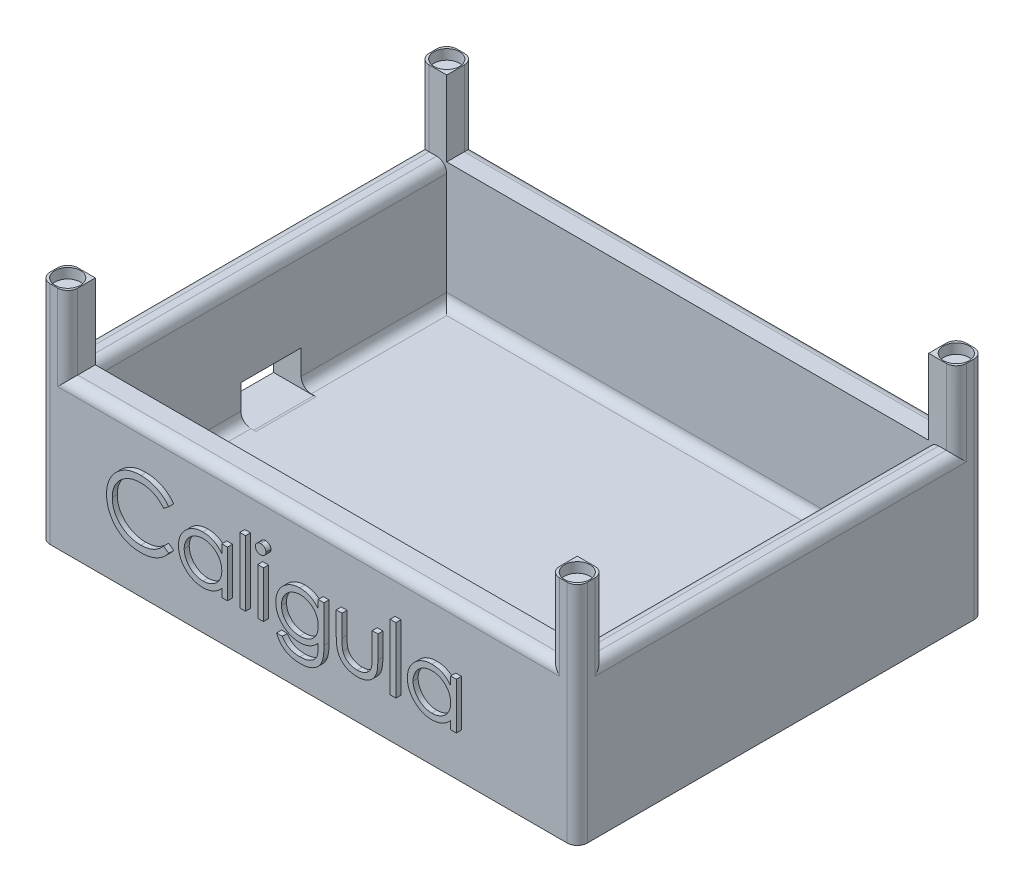
from build123d import *

# Parameters (mm, degrees)
SKETCH3_W                                  = 107
SKETCH3_H                                  = 81
BOSS_EXTRUDE1_DEPTH                        = 30
SHELL1_T                                   = -5.5
SKETCH4_W                                  = 5.5
SKETCH4_H                                  = 5.5
BOSS_EXTRUDE2_DEPTH                        = 15
MIRROR1_AT_THE_SECOND_PLANE_COPY_1_SKETC_W = 5.5
MIRROR1_AT_THE_SECOND_PLANE_COPY_1_SKETC_H = 5.5
MIRROR1_AT_THE_SECOND_PLANE_COPY_1_DEPTH   = 15
SKETCH5_R                                  = 2.55
CUT_EXTRUDE1_DEPTH                         = 2
MIRROR2_AT_THE_SECOND_PLANE_COPY_1_SKETC_R = 2.55
MIRROR2_AT_THE_SECOND_PLANE_COPY_1_DEPTH   = 2
SKETCH6_W                                  = 12
SKETCH6_H                                  = 7
CUT_EXTRUDE2_DEPTH                         = 8
FILLET4_R                                  = 2
FILLET5_R                                  = 2
WRAP1_START                                = -1
WRAP1_OUTLINE_W                            = 1.13974359
WRAP1_OUTLINE_H                            = 13.025641025
WRAP1_OUTLINE_H_2                          = 9.28076923
WRAP1_DEPTH                                = 2


with BuildPart() as part:
    # Sketch3 → Boss-Extrude1 (new body)
    with BuildSketch(Plane(origin=(0, 0, 0), x_dir=(1, 0, 0), z_dir=(0, 1, 0))):
        Rectangle(SKETCH3_W, SKETCH3_H)
    extrude(amount=BOSS_EXTRUDE1_DEPTH)

    # Shell1
    shell1_openings = [part.faces().sort_by_distance(p)[0] for p in [
        (0, 30, 0),
    ]]
    offset(amount=SHELL1_T, openings=shell1_openings, kind=Kind.INTERSECTION)

    # Sketch4 → Boss-Extrude2 (add)
    with BuildSketch(Plane(origin=(0, 30, 0), x_dir=(1, 0, 0), z_dir=(0, 1, 0))):
        with Locations((-50.75, 37.75)):
            Rectangle(SKETCH4_W, SKETCH4_H)
    boss_extrude2 = extrude(amount=BOSS_EXTRUDE2_DEPTH)

    # Mirror1: Boss-Extrude2 across plane
    add(boss_extrude2.mirror(Plane(origin=(0, 0, 0), x_dir=(0, 0, 1), z_dir=(1, 0, 0))))

    # Mirror1 at the second plane: Boss-Extrude2 across plane
    add(boss_extrude2.mirror(Plane.XY))

    # Mirror1 at the second plane copy 1 sketc → Mirror1 at the second plane copy 1 (add)
    with BuildSketch(Plane(origin=(0, 30, 0), x_dir=(-1, 0, 0), z_dir=(0, 1, 0))):
        with Locations((-50.75, 37.75)):
            Rectangle(MIRROR1_AT_THE_SECOND_PLANE_COPY_1_SKETC_W, MIRROR1_AT_THE_SECOND_PLANE_COPY_1_SKETC_H)
    extrude(amount=MIRROR1_AT_THE_SECOND_PLANE_COPY_1_DEPTH)

    # Sketch5 → Cut-Extrude1 (cut)
    with BuildSketch(Plane(origin=(0, 45, 0), x_dir=(1, 0, 0), z_dir=(0, 1, 0))):
        with Locations(Location((-50.75, 37.75, 0), (0, 0, 270))):
            Circle(SKETCH5_R)
    cut_extrude1 = extrude(amount=-CUT_EXTRUDE1_DEPTH, mode=Mode.SUBTRACT)

    # Mirror2: Cut-Extrude1 across plane
    add(cut_extrude1.mirror(Plane(origin=(0, 0, 0), x_dir=(0, 0, 1), z_dir=(1, 0, 0))), mode=Mode.SUBTRACT)

    # Mirror2 at the second plane: Cut-Extrude1 across plane
    add(cut_extrude1.mirror(Plane.XY), mode=Mode.SUBTRACT)

    # Mirror2 at the second plane copy 1 sketc → Mirror2 at the second plane copy 1 (cut)
    with BuildSketch(Plane(origin=(0, 45, 0), x_dir=(-1, 0, 0), z_dir=(0, 1, 0))):
        with Locations(Location((-50.75, 37.75, 0), (0, 0, 270))):
            Circle(MIRROR2_AT_THE_SECOND_PLANE_COPY_1_SKETC_R)
    extrude(amount=-MIRROR2_AT_THE_SECOND_PLANE_COPY_1_DEPTH, mode=Mode.SUBTRACT)

    # Sketch6 → Cut-Extrude2 (cut)
    with BuildSketch(Plane.ZY.offset(53.5)):
        with Locations((0, 8.935337708)):
            Rectangle(SKETCH6_W, SKETCH6_H)
    extrude(amount=-CUT_EXTRUDE2_DEPTH, mode=Mode.SUBTRACT)

    # Fillet4
    # the kernel refuses this fillet: 2 mm, written as the material it takes off along each edge
    with BuildSketch(Plane(origin=(-48, 30, 35), x_dir=(-1, 0, 0), z_dir=(0, 0, -1)), Plane(origin=(48, 30, -35), x_dir=(1, 0, 0), z_dir=(0, 0, 1))) as fillet4_piece_1:
        with BuildLine():
            CenterArc((FILLET4_R, -FILLET4_R), FILLET4_R, 90, 90)
            Line((0, -FILLET4_R), (0, 0))
            Line((0, 0), (FILLET4_R, 0))
        make_face()
    extrude(amount=70, mode=Mode.SUBTRACT)
    with BuildSketch(Plane(origin=(-53.5, 30, -35), x_dir=(0, -1, 0), z_dir=(0, 0, 1)), Plane(origin=(53.5, 30, 35), x_dir=(0, -1, 0), z_dir=(0, 0, -1))) as fillet4_piece_2:
        with BuildLine():
            CenterArc((FILLET4_R, FILLET4_R), FILLET4_R, 180, 90)
            Line((0, FILLET4_R), (0, 0))
            Line((0, 0), (FILLET4_R, 0))
        make_face()
    extrude(amount=70, mode=Mode.SUBTRACT)
    with BuildSketch(Plane(origin=(-53.5, 30, -35), x_dir=(0, 0, -1), z_dir=(0, 1, 0)), Plane(origin=(-48, 30, 40.5), x_dir=(-1, 0, 0), z_dir=(0, 1, 0)), Plane(origin=(48, 30, -40.5), x_dir=(1, 0, 0), z_dir=(0, 1, 0)), Plane(origin=(53.5, 30, 35), x_dir=(0, 0, 1), z_dir=(0, 1, 0))) as fillet4_piece_3:
        with BuildLine():
            CenterArc((FILLET4_R, -FILLET4_R), FILLET4_R, 90, 90)
            Line((0, -FILLET4_R), (0, 0))
            Line((0, 0), (FILLET4_R, 0))
        make_face()
    extrude(amount=20, mode=Mode.SUBTRACT)
    with BuildSketch(Plane(origin=(-48, 30, -40.5), x_dir=(-1, 0, 0), z_dir=(0, 1, 0)), Plane(origin=(-53.5, 30, 35), x_dir=(0, 0, 1), z_dir=(0, 1, 0)), Plane(origin=(53.5, 30, -35), x_dir=(0, 0, -1), z_dir=(0, 1, 0)), Plane(origin=(48, 30, 40.5), x_dir=(1, 0, 0), z_dir=(0, 1, 0))) as fillet4_piece_4:
        with BuildLine():
            CenterArc((FILLET4_R, FILLET4_R), FILLET4_R, 180, 90)
            Line((0, FILLET4_R), (0, 0))
            Line((0, 0), (FILLET4_R, 0))
        make_face()
    extrude(amount=20, mode=Mode.SUBTRACT)
    with BuildSketch(Plane(origin=(-48, 30, 40.5), x_dir=(0, -1, 0), z_dir=(1, 0, 0)), Plane(origin=(48, 30, -40.5), x_dir=(0, -1, 0), z_dir=(-1, 0, 0))) as fillet4_piece_5:
        with BuildLine():
            CenterArc((FILLET4_R, FILLET4_R), FILLET4_R, 180, 90)
            Line((0, FILLET4_R), (0, 0))
            Line((0, 0), (FILLET4_R, 0))
        make_face()
    extrude(amount=96, mode=Mode.SUBTRACT)
    with BuildSketch(Plane(origin=(-53.5, -5, -40.5), x_dir=(1, 0, 0), z_dir=(0, 1, 0)), Plane(origin=(53.5, 50, -40.5), x_dir=(-1, 0, 0), z_dir=(0, -1, 0)), Plane(origin=(53.5, 50, 40.5), x_dir=(0, 0, -1), z_dir=(0, -1, 0)), Plane(origin=(-53.5, -5, 40.5), x_dir=(0, 0, -1), z_dir=(0, 1, 0))) as fillet4_piece_6:
        with BuildLine():
            CenterArc((FILLET4_R, -FILLET4_R), FILLET4_R, 90, 90)
            Line((0, -FILLET4_R), (0, 0))
            Line((0, 0), (FILLET4_R, 0))
        make_face()
    extrude(amount=55, mode=Mode.SUBTRACT)
    with BuildSketch(Plane(origin=(-53.5, 25, -35), x_dir=(0, 0, -1), z_dir=(0, 1, 0))) as fillet4_piece_7a_section:
        with BuildLine():
            CenterArc((FILLET4_R, -FILLET4_R), FILLET4_R, 90, 90)
            Line((0, -FILLET4_R), (0, 0))
            Line((0, 0), (FILLET4_R, 0))
        make_face()
    fillet4_piece_7a = extrude(amount=25, mode=Mode.PRIVATE)
    fillet4_piece_7a = split(fillet4_piece_7a, bisect_by=Plane(origin=(-53.5, 30, -35), z_dir=(0, -1, 0)), keep=Keep.TOP, mode=Mode.PRIVATE)
    with BuildSketch(Plane(origin=(-53.5, 30, -40), x_dir=(0, -1, 0), z_dir=(0, 0, 1))) as fillet4_piece_7b_section:
        with BuildLine():
            CenterArc((FILLET4_R, FILLET4_R), FILLET4_R, 180, 90)
            Line((0, FILLET4_R), (0, 0))
            Line((0, 0), (FILLET4_R, 0))
        make_face()
    fillet4_piece_7b = extrude(amount=75, mode=Mode.PRIVATE)
    fillet4_piece_7b = split(fillet4_piece_7b, bisect_by=Plane(origin=(-53.5, 30, -35), z_dir=(0, 0, -1)), keep=Keep.TOP, mode=Mode.PRIVATE)
    fillet4_piece_7 = fillet4_piece_7a & fillet4_piece_7b
    add(fillet4_piece_7, mode=Mode.SUBTRACT)
    with BuildSketch(Plane(origin=(-53.5, 30, -35), x_dir=(0, -1, 0), z_dir=(0, 0, 1))) as fillet4_piece_8a_section:
        with BuildLine():
            CenterArc((FILLET4_R, FILLET4_R), FILLET4_R, 180, 90)
            Line((0, FILLET4_R), (0, 0))
            Line((0, 0), (FILLET4_R, 0))
        make_face()
    fillet4_piece_8a = extrude(amount=75, mode=Mode.PRIVATE)
    fillet4_piece_8a = split(fillet4_piece_8a, bisect_by=Plane(origin=(-53.5, 30, 35), z_dir=(0, 0, 1)), keep=Keep.TOP, mode=Mode.PRIVATE)
    with BuildSketch(Plane(origin=(-53.5, 25, 35), x_dir=(0, 0, 1), z_dir=(0, 1, 0))) as fillet4_piece_8b_section:
        with BuildLine():
            CenterArc((FILLET4_R, FILLET4_R), FILLET4_R, 180, 90)
            Line((0, FILLET4_R), (0, 0))
            Line((0, 0), (FILLET4_R, 0))
        make_face()
    fillet4_piece_8b = extrude(amount=25, mode=Mode.PRIVATE)
    fillet4_piece_8b = split(fillet4_piece_8b, bisect_by=Plane(origin=(-53.5, 30, 35), z_dir=(0, -1, 0)), keep=Keep.TOP, mode=Mode.PRIVATE)
    fillet4_piece_8 = fillet4_piece_8a & fillet4_piece_8b
    add(fillet4_piece_8, mode=Mode.SUBTRACT)
    with BuildSketch(Plane(origin=(48, 30, -40.5), x_dir=(0, -1, 0), z_dir=(-1, 0, 0))) as fillet4_piece_9a_section:
        with BuildLine():
            CenterArc((FILLET4_R, FILLET4_R), FILLET4_R, 180, 90)
            Line((0, FILLET4_R), (0, 0))
            Line((0, 0), (FILLET4_R, 0))
        make_face()
    fillet4_piece_9a = extrude(amount=101, mode=Mode.PRIVATE)
    fillet4_piece_9a = split(fillet4_piece_9a, bisect_by=Plane(origin=(-48, 30, -40.5), z_dir=(-1, 0, 0)), keep=Keep.TOP, mode=Mode.PRIVATE)
    with BuildSketch(Plane(origin=(-48, 25, -40.5), x_dir=(-1, 0, 0), z_dir=(0, 1, 0))) as fillet4_piece_9b_section:
        with BuildLine():
            CenterArc((FILLET4_R, FILLET4_R), FILLET4_R, 180, 90)
            Line((0, FILLET4_R), (0, 0))
            Line((0, 0), (FILLET4_R, 0))
        make_face()
    fillet4_piece_9b = extrude(amount=25, mode=Mode.PRIVATE)
    fillet4_piece_9b = split(fillet4_piece_9b, bisect_by=Plane(origin=(-48, 30, -40.5), z_dir=(0, -1, 0)), keep=Keep.TOP, mode=Mode.PRIVATE)
    fillet4_piece_9 = fillet4_piece_9a & fillet4_piece_9b
    add(fillet4_piece_9, mode=Mode.SUBTRACT)
    with BuildSketch(Plane(origin=(-48, 25, 40.5), x_dir=(-1, 0, 0), z_dir=(0, 1, 0))) as fillet4_piece_10a_section:
        with BuildLine():
            CenterArc((FILLET4_R, -FILLET4_R), FILLET4_R, 90, 90)
            Line((0, -FILLET4_R), (0, 0))
            Line((0, 0), (FILLET4_R, 0))
        make_face()
    fillet4_piece_10a = extrude(amount=25, mode=Mode.PRIVATE)
    fillet4_piece_10a = split(fillet4_piece_10a, bisect_by=Plane(origin=(-48, 30, 40.5), z_dir=(0, -1, 0)), keep=Keep.TOP, mode=Mode.PRIVATE)
    with BuildSketch(Plane(origin=(-53, 30, 40.5), x_dir=(0, -1, 0), z_dir=(1, 0, 0))) as fillet4_piece_10b_section:
        with BuildLine():
            CenterArc((FILLET4_R, FILLET4_R), FILLET4_R, 180, 90)
            Line((0, FILLET4_R), (0, 0))
            Line((0, 0), (FILLET4_R, 0))
        make_face()
    fillet4_piece_10b = extrude(amount=101, mode=Mode.PRIVATE)
    fillet4_piece_10b = split(fillet4_piece_10b, bisect_by=Plane(origin=(-48, 30, 40.5), z_dir=(-1, 0, 0)), keep=Keep.TOP, mode=Mode.PRIVATE)
    fillet4_piece_10 = fillet4_piece_10a & fillet4_piece_10b
    add(fillet4_piece_10, mode=Mode.SUBTRACT)
    with BuildSketch(Plane(origin=(-48, 30, 40.5), x_dir=(0, -1, 0), z_dir=(1, 0, 0))) as fillet4_piece_11a_section:
        with BuildLine():
            CenterArc((FILLET4_R, FILLET4_R), FILLET4_R, 180, 90)
            Line((0, FILLET4_R), (0, 0))
            Line((0, 0), (FILLET4_R, 0))
        make_face()
    fillet4_piece_11a = extrude(amount=101, mode=Mode.PRIVATE)
    fillet4_piece_11a = split(fillet4_piece_11a, bisect_by=Plane(origin=(48, 30, 40.5), z_dir=(1, 0, 0)), keep=Keep.TOP, mode=Mode.PRIVATE)
    with BuildSketch(Plane(origin=(48, 25, 40.5), x_dir=(1, 0, 0), z_dir=(0, 1, 0))) as fillet4_piece_11b_section:
        with BuildLine():
            CenterArc((FILLET4_R, FILLET4_R), FILLET4_R, 180, 90)
            Line((0, FILLET4_R), (0, 0))
            Line((0, 0), (FILLET4_R, 0))
        make_face()
    fillet4_piece_11b = extrude(amount=25, mode=Mode.PRIVATE)
    fillet4_piece_11b = split(fillet4_piece_11b, bisect_by=Plane(origin=(48, 30, 40.5), z_dir=(0, -1, 0)), keep=Keep.TOP, mode=Mode.PRIVATE)
    fillet4_piece_11 = fillet4_piece_11a & fillet4_piece_11b
    add(fillet4_piece_11, mode=Mode.SUBTRACT)
    with BuildSketch(Plane(origin=(48, 25, -40.5), x_dir=(1, 0, 0), z_dir=(0, 1, 0))) as fillet4_piece_12a_section:
        with BuildLine():
            CenterArc((FILLET4_R, -FILLET4_R), FILLET4_R, 90, 90)
            Line((0, -FILLET4_R), (0, 0))
            Line((0, 0), (FILLET4_R, 0))
        make_face()
    fillet4_piece_12a = extrude(amount=25, mode=Mode.PRIVATE)
    fillet4_piece_12a = split(fillet4_piece_12a, bisect_by=Plane(origin=(48, 30, -40.5), z_dir=(0, -1, 0)), keep=Keep.TOP, mode=Mode.PRIVATE)
    with BuildSketch(Plane(origin=(53, 30, -40.5), x_dir=(0, -1, 0), z_dir=(-1, 0, 0))) as fillet4_piece_12b_section:
        with BuildLine():
            CenterArc((FILLET4_R, FILLET4_R), FILLET4_R, 180, 90)
            Line((0, FILLET4_R), (0, 0))
            Line((0, 0), (FILLET4_R, 0))
        make_face()
    fillet4_piece_12b = extrude(amount=101, mode=Mode.PRIVATE)
    fillet4_piece_12b = split(fillet4_piece_12b, bisect_by=Plane(origin=(48, 30, -40.5), z_dir=(1, 0, 0)), keep=Keep.TOP, mode=Mode.PRIVATE)
    fillet4_piece_12 = fillet4_piece_12a & fillet4_piece_12b
    add(fillet4_piece_12, mode=Mode.SUBTRACT)
    with BuildSketch(Plane(origin=(53.5, 30, 35), x_dir=(0, -1, 0), z_dir=(0, 0, -1))) as fillet4_piece_13a_section:
        with BuildLine():
            CenterArc((FILLET4_R, FILLET4_R), FILLET4_R, 180, 90)
            Line((0, FILLET4_R), (0, 0))
            Line((0, 0), (FILLET4_R, 0))
        make_face()
    fillet4_piece_13a = extrude(amount=75, mode=Mode.PRIVATE)
    fillet4_piece_13a = split(fillet4_piece_13a, bisect_by=Plane(origin=(53.5, 30, -35), z_dir=(0, 0, -1)), keep=Keep.TOP, mode=Mode.PRIVATE)
    with BuildSketch(Plane(origin=(53.5, 25, -35), x_dir=(0, 0, -1), z_dir=(0, 1, 0))) as fillet4_piece_13b_section:
        with BuildLine():
            CenterArc((FILLET4_R, FILLET4_R), FILLET4_R, 180, 90)
            Line((0, FILLET4_R), (0, 0))
            Line((0, 0), (FILLET4_R, 0))
        make_face()
    fillet4_piece_13b = extrude(amount=25, mode=Mode.PRIVATE)
    fillet4_piece_13b = split(fillet4_piece_13b, bisect_by=Plane(origin=(53.5, 30, -35), z_dir=(0, -1, 0)), keep=Keep.TOP, mode=Mode.PRIVATE)
    fillet4_piece_13 = fillet4_piece_13a & fillet4_piece_13b
    add(fillet4_piece_13, mode=Mode.SUBTRACT)
    with BuildSketch(Plane(origin=(53.5, 25, 35), x_dir=(0, 0, 1), z_dir=(0, 1, 0))) as fillet4_piece_14a_section:
        with BuildLine():
            CenterArc((FILLET4_R, -FILLET4_R), FILLET4_R, 90, 90)
            Line((0, -FILLET4_R), (0, 0))
            Line((0, 0), (FILLET4_R, 0))
        make_face()
    fillet4_piece_14a = extrude(amount=25, mode=Mode.PRIVATE)
    fillet4_piece_14a = split(fillet4_piece_14a, bisect_by=Plane(origin=(53.5, 30, 35), z_dir=(0, -1, 0)), keep=Keep.TOP, mode=Mode.PRIVATE)
    with BuildSketch(Plane(origin=(53.5, 30, 40), x_dir=(0, -1, 0), z_dir=(0, 0, -1))) as fillet4_piece_14b_section:
        with BuildLine():
            CenterArc((FILLET4_R, FILLET4_R), FILLET4_R, 180, 90)
            Line((0, FILLET4_R), (0, 0))
            Line((0, 0), (FILLET4_R, 0))
        make_face()
    fillet4_piece_14b = extrude(amount=75, mode=Mode.PRIVATE)
    fillet4_piece_14b = split(fillet4_piece_14b, bisect_by=Plane(origin=(53.5, 30, 35), z_dir=(0, 0, 1)), keep=Keep.TOP, mode=Mode.PRIVATE)
    fillet4_piece_14 = fillet4_piece_14a & fillet4_piece_14b
    add(fillet4_piece_14, mode=Mode.SUBTRACT)

    # Fillet5
    # the kernel refuses this fillet: 2 mm, written as the material it adds along each edge
    with BuildSketch(Plane(origin=(-53, 5.5, 35), x_dir=(0, 1, 0), z_dir=(1, 0, 0)), Plane(origin=(53, 5.5, -35), x_dir=(0, 1, 0), z_dir=(-1, 0, 0))) as fillet5_piece_1:
        with BuildLine():
            CenterArc((FILLET5_R, -FILLET5_R), FILLET5_R, 90, 90)
            Line((0, -FILLET5_R), (0, 0))
            Line((0, 0), (FILLET5_R, 0))
        make_face()
    extrude(amount=106)
    with BuildSketch(Plane(origin=(48, 5.5, 40), x_dir=(0, 1, 0), z_dir=(0, 0, -1))) as fillet5_piece_2:
        with BuildLine():
            CenterArc((FILLET5_R, -FILLET5_R), FILLET5_R, 90, 90)
            Line((0, -FILLET5_R), (0, 0))
            Line((0, 0), (FILLET5_R, 0))
        make_face()
    extrude(amount=80)
    with BuildSketch(Plane(origin=(-48, 5.5, 6), x_dir=(0, 1, 0), z_dir=(0, 0, 1)), Plane(origin=(-48, 5.5, -40), x_dir=(0, 1, 0), z_dir=(0, 0, 1))) as fillet5_piece_3:
        with BuildLine():
            CenterArc((FILLET5_R, -FILLET5_R), FILLET5_R, 90, 90)
            Line((0, -FILLET5_R), (0, 0))
            Line((0, 0), (FILLET5_R, 0))
        make_face()
    extrude(amount=34)
    # the kernel refuses this fillet: 2 mm, written as the material it takes off along each edge
    with BuildSketch(Plane(origin=(-45.5, 5.5, 6), x_dir=(1, 0, 0), z_dir=(0, 0, -1))) as fillet5_2_piece_1:
        with BuildLine():
            CenterArc((0.504448171, 2), FILLET5_R, 255.390838786, 14.609161214)
            Line((0, 0.064662292), (0, 0))
            Line((0, 0), (0.504448171, 0))
        make_face()
    extrude(amount=12, mode=Mode.SUBTRACT)

    # Wrap1: read off the stored shape, not the designer's step
    # Wrap1 outline → Wrap1 (add)
    # profile 1 of 9: a face of its own
    with BuildSketch(Plane.XY.offset(40.5).offset(WRAP1_START)):
        with BuildLine():
            add(Edge.make_bspline(
                [(-27.887582676, 18.558024246), (-27.958724042, 18.642809336), (-28.100047635, 18.811236431), (-28.327411027, 19.047745063), (-28.564362703, 19.269324726), (-28.810812086, 19.477030975), (-29.071195176, 19.663600382), (-29.33920436, 19.838755527), (-29.619322981, 19.995755605), (-30.006679275, 20.186121298), (-30.513401468, 20.384771631), (-31.151285598, 20.551334785), (-31.817168727, 20.657365908), (-32.27145716, 20.668849761), (-32.502526586, 20.674690913)],
                knots=[0, 0, 0, 0, 0.063163259, 0.125474941, 0.18712122, 0.248294346, 0.309294856, 0.369850066, 0.430973376, 0.49245599, 0.616147966, 0.740843698, 0.868182649, 1, 1, 1, 1], degree=3))
            Line((-27.887582676, 18.558024246), (-26.890307035, 19.3212454))
            add(Edge.make_bspline(
                [(-32.431292612, 21.977255015), (-32.285371528, 21.975505542), (-31.996535438, 21.972042637), (-31.569261528, 21.938274636), (-31.153273656, 21.881982407), (-30.748285235, 21.80536124), (-30.352326028, 21.710266102), (-29.968422297, 21.586385591), (-29.594321347, 21.444738749), (-29.232382566, 21.281603744), (-28.884342513, 21.098481568), (-28.550309586, 20.897402019), (-28.232937098, 20.678614382), (-27.929991848, 20.443979431), (-27.646541597, 20.188533231), (-27.374538517, 19.919301954), (-27.123219748, 19.628530649), (-26.968086726, 19.423861317), (-26.890307035, 19.3212454)],
                knots=[0, 0, 0, 0, 0.068547537, 0.135682946, 0.20121499, 0.265682235, 0.329266835, 0.392395428, 0.455069762, 0.51712685, 0.578790035, 0.639739863, 0.700191504, 0.759806243, 0.819628319, 0.879354791, 0.939511608, 1, 1, 1, 1], degree=3))
            add(Edge.make_bspline(
                [(-39.264666009, 15.375392034), (-39.259022879, 15.603830394), (-39.247920371, 16.053268606), (-39.15359277, 16.71284838), (-39.001850281, 17.34476917), (-38.786324428, 17.947851329), (-38.513073582, 18.525266917), (-38.175519869, 19.072605003), (-37.77758481, 19.593365962), (-37.32238935, 20.07964806), (-36.823216448, 20.524290853), (-36.288659609, 20.915473364), (-35.719765115, 21.241019779), (-35.122800339, 21.513148712), (-34.493295152, 21.722315763), (-33.832592641, 21.868740184), (-33.141934293, 21.959879434), (-32.670719206, 21.971400903), (-32.431292612, 21.977255015)],
                knots=[0, 0, 0, 0, 0.064557846, 0.127013532, 0.18795481, 0.248013913, 0.307747682, 0.368234515, 0.429469844, 0.492743437, 0.556257769, 0.618216786, 0.679655476, 0.741245546, 0.803415265, 0.866815462, 0.932328312, 1, 1, 1, 1], degree=3))
            add(Edge.make_bspline(
                [(-37.654269375, 10.846946522), (-37.782850138, 11.004938836), (-38.038459326, 11.319016042), (-38.365486806, 11.828053745), (-38.645422221, 12.359524103), (-38.871757705, 12.916219273), (-39.048696765, 13.496890079), (-39.171274244, 14.101829231), (-39.250927209, 14.730471764), (-39.260035971, 15.158050969), (-39.264666009, 15.375392034)],
                knots=[0, 0, 0, 0, 0.12432851, 0.247156016, 0.368779749, 0.490733862, 0.613613772, 0.738957576, 0.867310575, 1, 1, 1, 1], degree=3))
            add(Edge.make_bspline(
                [(-32.416028189, 8.625972964), (-32.552620924, 8.626923623), (-32.822716142, 8.628803432), (-33.221491612, 8.659255011), (-33.609710948, 8.7008012), (-33.986264591, 8.763358247), (-34.353207414, 8.837179138), (-34.707212964, 8.93613484), (-35.051764727, 9.046984673), (-35.385478421, 9.177268482), (-35.708637903, 9.324284345), (-36.020200875, 9.490442287), (-36.320024044, 9.674345053), (-36.611055143, 9.871938948), (-36.888994946, 10.089570872), (-37.156252024, 10.324218374), (-37.414325009, 10.575090585), (-37.573991895, 10.755992481), (-37.654269375, 10.846946522)],
                knots=[0, 0, 0, 0, 0.069662801, 0.137749562, 0.203916744, 0.268779862, 0.332413706, 0.39475354, 0.456180032, 0.516995649, 0.577395938, 0.637198344, 0.696999184, 0.756756194, 0.816553905, 0.876947997, 0.938131788, 1, 1, 1, 1], degree=3))
            add(Edge.make_bspline(
                [(-26.890307035, 11.289614791), (-26.970564177, 11.18606098), (-27.130694033, 10.979449374), (-27.389984551, 10.688177742), (-27.663133602, 10.414205956), (-27.952170035, 10.159742873), (-28.253768879, 9.919696669), (-28.573345555, 9.700887167), (-28.906698902, 9.500260244), (-29.25269944, 9.316556832), (-29.610979549, 9.153571393), (-29.981109927, 9.01403915), (-30.361495158, 8.893843122), (-30.752152632, 8.794957523), (-31.153892664, 8.717773876), (-31.565265527, 8.66617677), (-31.987159074, 8.630827538), (-32.271789373, 8.627605672), (-32.416028189, 8.625972964)],
                knots=[0, 0, 0, 0, 0.061674239, 0.123053062, 0.183475001, 0.243726501, 0.304278917, 0.364862921, 0.425946204, 0.48739123, 0.549220384, 0.611143589, 0.67352853, 0.736961457, 0.800785283, 0.866012596, 0.932100748, 1, 1, 1, 1], degree=3))
            Line((-26.890307035, 11.289614791), (-27.887582676, 12.045203733))
            add(Edge.make_bspline(
                [(-32.4236604, 9.928537066), (-32.201944929, 9.934664924), (-31.765555842, 9.946726015), (-31.125591861, 10.048903862), (-30.512959226, 10.214576878), (-29.927624983, 10.446435053), (-29.371239267, 10.747843383), (-28.842931385, 11.113232824), (-28.342255401, 11.54607906), (-28.041188177, 11.876580697), (-27.887582676, 12.045203733)],
                knots=[0, 0, 0, 0, 0.12851519, 0.252948636, 0.374754734, 0.495939754, 0.617180641, 0.740909469, 0.867811148, 1, 1, 1, 1], degree=3))
            add(Edge.make_bspline(
                [(-38.12492242, 15.288893637), (-38.120343819, 15.101182848), (-38.111354345, 14.732637611), (-38.03135039, 14.192812824), (-37.909774773, 13.675666379), (-37.727563965, 13.184430952), (-37.502886267, 12.713049195), (-37.21898462, 12.269496784), (-36.890176041, 11.847070964), (-36.511808862, 11.455755126), (-36.096679187, 11.098291037), (-35.651279622, 10.783510355), (-35.176719492, 10.521110639), (-34.678238577, 10.302757918), (-34.152000963, 10.134912078), (-33.598952966, 10.01675083), (-33.02029744, 9.939672061), (-32.624894189, 9.932292678), (-32.4236604, 9.928537066)],
                knots=[0, 0, 0, 0, 0.064323217, 0.126290104, 0.186726469, 0.246146432, 0.305575643, 0.365429386, 0.426326309, 0.488839906, 0.551724972, 0.613918596, 0.675483766, 0.737333897, 0.800229044, 0.864502298, 0.931040739, 1, 1, 1, 1], degree=3))
            add(Edge.make_bspline(
                [(-32.502526586, 20.674690913), (-32.629828844, 20.673225106), (-32.883251874, 20.670307096), (-33.259347764, 20.631811128), (-33.628420835, 20.577704737), (-33.990231012, 20.497421421), (-34.344317748, 20.395920775), (-34.692995892, 20.274634273), (-35.031217212, 20.124575283), (-35.363660533, 19.958719596), (-35.68217367, 19.771385725), (-35.983544844, 19.567048706), (-36.266674899, 19.347995127), (-36.531787805, 19.11340397), (-36.779154589, 18.864331713), (-37.006982831, 18.598123959), (-37.214484177, 18.315631787), (-37.405771668, 18.02058028), (-37.577086444, 17.713828864), (-37.720523434, 17.39424218), (-37.847542021, 17.067293006), (-37.948050701, 16.729287365), (-38.027605377, 16.382603615), (-38.082497183, 16.026311327), (-38.12055535, 15.661154833), (-38.123458849, 15.41365247), (-38.12492242, 15.288893637)],
                knots=[0, 0, 0, 0, 0.043954909, 0.087501875, 0.130462627, 0.172752021, 0.215403067, 0.25764983, 0.300152749, 0.34312149, 0.385925163, 0.427685727, 0.46881795, 0.5094918, 0.549883031, 0.589980023, 0.63040523, 0.670868626, 0.711383944, 0.751627258, 0.791775577, 0.832458919, 0.873319045, 0.914542956, 0.956923558, 1, 1, 1, 1], degree=3))
        make_face()
    # profile 2 of 9: a face of its own
    with BuildSketch(Plane.XY.offset(40.5).offset(WRAP1_START)):
        with BuildLine():
            add(Edge.make_bspline(
                [(-16.306973702, 10.556922483), (-16.435493313, 10.411635956), (-16.686300952, 10.128107473), (-17.105187294, 9.757695018), (-17.549208968, 9.451522252), (-18.016210905, 9.204235415), (-18.505771388, 9.018481382), (-19.01680519, 8.886451604), (-19.549520772, 8.801565402), (-19.913293603, 8.79308898), (-20.097638766, 8.788793477)],
                knots=[0, 0, 0, 0, 0.134298379, 0.262084975, 0.386269912, 0.507164597, 0.627300236, 0.748144942, 0.872370177, 1, 1, 1, 1], degree=3))
            Line((-16.306973702, 10.556922483), (-16.306973702, 8.95161399))
            Line((-16.306973702, 8.95161399), (-15.167230112, 8.95161399))
            Line((-15.167230112, 8.95161399), (-15.167230112, 18.23238322))
            Line((-15.167230112, 18.23238322), (-16.306973702, 18.23238322))
            Line((-16.306973702, 18.23238322), (-16.306973702, 16.515135624))
            add(Edge.make_bspline(
                [(-20.062021779, 18.395203733), (-19.872610862, 18.389986749), (-19.501184992, 18.379756489), (-18.957886216, 18.294620307), (-18.44391911, 18.150789298), (-17.955316176, 17.955145805), (-17.493831972, 17.695163274), (-17.063835429, 17.36721313), (-16.66082639, 16.97336368), (-16.427217903, 16.670848067), (-16.306973702, 16.515135624)],
                knots=[0, 0, 0, 0, 0.129862142, 0.254653531, 0.376014554, 0.495255252, 0.614797719, 0.738105554, 0.8651963, 1, 1, 1, 1], degree=3))
            add(Edge.make_bspline(
                [(-24.936460881, 13.61743931), (-24.931914385, 13.778779034), (-24.922926207, 14.097738966), (-24.855967381, 14.566835956), (-24.74336915, 15.018659359), (-24.585352674, 15.451754553), (-24.382726152, 15.866645592), (-24.136244236, 16.263625911), (-23.845889126, 16.643789154), (-23.511144678, 16.998196177), (-23.148524226, 17.32556812), (-22.76059826, 17.610080942), (-22.357016639, 17.855796365), (-21.931519429, 18.050481836), (-21.490404506, 18.207994872), (-21.02974486, 18.316971642), (-20.551457132, 18.381187637), (-20.226734489, 18.390486809), (-20.062021779, 18.395203733)],
                knots=[0, 0, 0, 0, 0.063774532, 0.12607881, 0.186904093, 0.247573935, 0.308003356, 0.369131898, 0.432033228, 0.496790794, 0.561610823, 0.624913866, 0.686726349, 0.748078833, 0.809582291, 0.871630743, 0.934885821, 1, 1, 1, 1], degree=3))
            add(Edge.make_bspline(
                [(-20.097638766, 8.788793477), (-20.261533913, 8.793243456), (-20.584742399, 8.802019012), (-21.060190765, 8.870099371), (-21.517725498, 8.979430484), (-21.957778948, 9.131470855), (-22.37750359, 9.333149836), (-22.780493083, 9.574599507), (-23.164659709, 9.862130519), (-23.524147864, 10.190835651), (-23.855189694, 10.54786889), (-24.145697741, 10.928671303), (-24.387916059, 11.331596234), (-24.590463209, 11.75154225), (-24.746478516, 12.191742101), (-24.855239989, 12.650673539), (-24.923241038, 13.127793937), (-24.932012967, 13.452694492), (-24.936460881, 13.61743931)],
                knots=[0, 0, 0, 0, 0.064619991, 0.127433484, 0.189004127, 0.249930071, 0.310668454, 0.372328961, 0.43493911, 0.499575544, 0.564191208, 0.626735217, 0.688109334, 0.749293607, 0.810330528, 0.87190117, 0.935045915, 1, 1, 1, 1], degree=3))
        make_face()
        with BuildLine():
            add(Edge.make_bspline(
                [(-23.796717292, 13.604718957), (-23.789950393, 13.44654914), (-23.77644312, 13.130829477), (-23.679376314, 12.662814242), (-23.516526488, 12.206869575), (-23.294305289, 11.766865398), (-23.016042393, 11.358345948), (-22.693503568, 10.989174646), (-22.323569691, 10.671712426), (-21.913804165, 10.405964659), (-21.476169529, 10.191289226), (-21.015943549, 10.041916763), (-20.541777662, 9.945477387), (-20.219370622, 9.934212571), (-20.056933638, 9.928537066)],
                knots=[0, 0, 0, 0, 0.081589349, 0.162858895, 0.245483689, 0.330807139, 0.416493374, 0.499893203, 0.583048156, 0.667157852, 0.751311929, 0.833784789, 0.916256489, 1, 1, 1, 1], degree=3))
            add(Edge.make_bspline(
                [(-20.046757356, 17.255460143), (-20.21336081, 17.249532372), (-20.54220953, 17.237831895), (-21.024969195, 17.146488069), (-21.486935012, 16.994506827), (-21.925796481, 16.786655357), (-22.334621153, 16.525293941), (-22.69999533, 16.209167779), (-23.024907418, 15.846902042), (-23.298168833, 15.440131527), (-23.520928637, 15.004056739), (-23.677563295, 14.548219493), (-23.780865993, 14.080841431), (-23.791419768, 13.763839686), (-23.796717292, 13.604718957)],
                knots=[0, 0, 0, 0, 0.085920517, 0.169593435, 0.252475515, 0.336244477, 0.419504521, 0.502035907, 0.584774648, 0.669846475, 0.754184866, 0.836658238, 0.918009726, 1, 1, 1, 1], degree=3))
            add(Edge.make_bspline(
                [(-16.306973702, 13.571646041), (-16.310455883, 13.699871883), (-16.317309919, 13.952260918), (-16.369672271, 14.322837911), (-16.452965861, 14.677471716), (-16.57033625, 15.016535188), (-16.72451891, 15.338153673), (-16.910475089, 15.64463646), (-17.131474864, 15.934389541), (-17.383960647, 16.20342297), (-17.660331525, 16.448810419), (-17.952774572, 16.667846378), (-18.264754597, 16.847782782), (-18.591024988, 16.996703967), (-18.93215183, 17.115210025), (-19.290910937, 17.194268228), (-19.663488975, 17.248552822), (-19.91765609, 17.253133461), (-20.046757356, 17.255460143)],
                knots=[0, 0, 0, 0, 0.0656338, 0.129188088, 0.191218683, 0.251912818, 0.312507474, 0.373494434, 0.4351516, 0.498741474, 0.562095217, 0.624186567, 0.685475718, 0.746096815, 0.807611636, 0.869966581, 0.933951019, 1, 1, 1, 1], degree=3))
            add(Edge.make_bspline(
                [(-20.056933638, 9.928537066), (-19.892027756, 9.934560364), (-19.564046314, 9.946540106), (-19.079854431, 10.038274983), (-18.609972709, 10.189836051), (-18.160801909, 10.399927168), (-17.74236909, 10.660303859), (-17.366819648, 10.96512959), (-17.049261706, 11.319652572), (-16.780048522, 11.709275702), (-16.568954868, 12.136402089), (-16.41519031, 12.591186152), (-16.324280423, 13.073643724), (-16.312822376, 13.403349974), (-16.306973702, 13.571646041)],
                knots=[0, 0, 0, 0, 0.084802388, 0.16866354, 0.252551924, 0.338239689, 0.423102661, 0.505556051, 0.586175656, 0.66713572, 0.74849918, 0.830452399, 0.913455706, 1, 1, 1, 1], degree=3))
        make_face(mode=Mode.SUBTRACT)
    # profile 3 of 9: a face of its own
    with BuildSketch(Plane.XY.offset(40.5).offset(WRAP1_START)):
        with BuildLine():
            add(Edge.make_bspline(
                [(-7.514666009, 21.15806431), (-7.518592704, 21.093974111), (-7.526355313, 20.967275374), (-7.588456457, 20.785217346), (-7.686508577, 20.616110375), (-7.824391118, 20.469259512), (-7.986257194, 20.344216691), (-8.168588503, 20.25094521), (-8.36886913, 20.195935569), (-8.507362409, 20.189510498), (-8.578087484, 20.186229374)],
                knots=[0, 0, 0, 0, 0.120162135, 0.23754632, 0.357497051, 0.484917122, 0.613329268, 0.74015037, 0.867301255, 1, 1, 1, 1], degree=3))
            add(Edge.make_bspline(
                [(-8.578087484, 22.140075528), (-8.507361852, 22.136794746), (-8.368867482, 22.130370346), (-8.168594768, 22.075355844), (-7.98623361, 21.982102699), (-7.824480122, 21.856990714), (-7.685680419, 21.709854162), (-7.588504698, 21.538364363), (-7.526048289, 21.353094445), (-7.518506103, 21.22386255), (-7.514666009, 21.15806431)],
                knots=[0, 0, 0, 0, 0.131899264, 0.258284092, 0.384341125, 0.511979615, 0.638632008, 0.759229763, 0.877412168, 1, 1, 1, 1], degree=3))
            add(Edge.make_bspline(
                [(-9.631332676, 21.15806431), (-9.627482448, 21.223853393), (-9.619920356, 21.353067303), (-9.557610106, 21.538469279), (-9.460147375, 21.708945014), (-9.324146473, 21.857808969), (-9.162190774, 21.982070976), (-8.981354584, 22.074276537), (-8.78408839, 22.130778254), (-8.648004348, 22.136920026), (-8.578087484, 22.140075528)],
                knots=[0, 0, 0, 0, 0.123289869, 0.242149081, 0.363437476, 0.489745393, 0.618114845, 0.744893781, 0.868932267, 1, 1, 1, 1], degree=3))
            add(Edge.make_bspline(
                [(-8.578087484, 20.186229374), (-8.648003797, 20.189385216), (-8.784086765, 20.19552765), (-8.981360735, 20.252024572), (-9.162166968, 20.344248608), (-9.324235923, 20.468440766), (-9.459328338, 20.61701225), (-9.557656548, 20.785114145), (-9.619614267, 20.967301649), (-9.627396205, 21.093982938), (-9.631332676, 21.15806431)],
                knots=[0, 0, 0, 0, 0.131866752, 0.256661403, 0.384213213, 0.513365233, 0.640443152, 0.761085005, 0.879145525, 1, 1, 1, 1], degree=3))
        make_face()
    # profile 4 of 9: a face of its own
    with BuildSketch(Plane.XY.offset(40.5).offset(WRAP1_START)):
        with BuildLine():
            add(Edge.make_bspline(
                [(4.045590401, 10.867299086), (4.044585132, 10.710408385), (4.042644721, 10.407571541), (4.028671197, 9.969681784), (3.99920474, 9.565219131), (3.965790382, 9.192338935), (3.917723725, 8.852769565), (3.859026621, 8.545497765), (3.792857157, 8.270228667), (3.734726653, 8.100684244), (3.707229023, 8.020484182)],
                knots=[0, 0, 0, 0, 0.163445255, 0.315488713, 0.456290824, 0.58586415, 0.705428686, 0.813370713, 0.911718238, 1, 1, 1, 1], degree=3))
            Line((4.045590401, 10.867299086), (4.045590401, 18.23238322))
            Line((4.045590401, 18.23238322), (2.905846811, 18.23238322))
            Line((2.905846811, 18.23238322), (2.905846811, 16.609266233))
            add(Edge.make_bspline(
                [(-0.767791009, 18.395203733), (-0.597063317, 18.390280947), (-0.259928582, 18.380559958), (0.236209627, 18.30428323), (0.714971469, 18.182675239), (1.179058554, 18.008447094), (1.632251345, 17.770594098), (2.073056209, 17.457292543), (2.502748496, 17.065732168), (2.767916624, 16.765457488), (2.905846811, 16.609266233)],
                knots=[0, 0, 0, 0, 0.120911079, 0.238762229, 0.354754859, 0.470359399, 0.589144099, 0.716328905, 0.852445286, 1, 1, 1, 1], degree=3))
            add(Edge.make_bspline(
                [(-5.560819856, 13.622527451), (-5.558936024, 13.727767257), (-5.555175656, 13.937839258), (-5.522696388, 14.249458743), (-5.476366101, 14.55690555), (-5.403040768, 14.857010693), (-5.314784758, 15.153191935), (-5.205479223, 15.443261591), (-5.074056867, 15.72730801), (-4.925250062, 16.005541539), (-4.75803064, 16.274228598), (-4.574669924, 16.529413856), (-4.374946551, 16.769219509), (-4.161615886, 16.996064811), (-3.932073121, 17.207761086), (-3.686437006, 17.40379453), (-3.427128841, 17.58745114), (-3.153344962, 17.754769421), (-2.869309867, 17.902750715), (-2.582239728, 18.037779281), (-2.288331847, 18.144945943), (-1.993065775, 18.239372617), (-1.691241513, 18.30626604), (-1.386559827, 18.35787246), (-1.07797763, 18.38931302), (-0.871319983, 18.393237628), (-0.767791009, 18.395203733)],
                knots=[0, 0, 0, 0, 0.042034119, 0.083905433, 0.125068934, 0.16615847, 0.207210273, 0.248490732, 0.289878112, 0.332169514, 0.374475842, 0.41622498, 0.457609587, 0.49907317, 0.540553362, 0.582248849, 0.62454975, 0.667432801, 0.710322543, 0.752467119, 0.794064757, 0.835215707, 0.876228344, 0.917446189, 0.95864314, 1, 1, 1, 1], degree=3))
            add(Edge.make_bspline(
                [(-0.803407997, 8.95161399), (-0.909493889, 8.9534828), (-1.120410255, 8.957198305), (-1.433754623, 8.989705869), (-1.742475071, 9.036872734), (-2.045851595, 9.106111098), (-2.344321963, 9.194981077), (-2.63739294, 9.306076101), (-2.927437451, 9.43167953), (-3.209183314, 9.579626559), (-3.479824417, 9.74422693), (-3.737319403, 9.922530905), (-3.980319531, 10.113605265), (-4.206511935, 10.319334161), (-4.415599915, 10.539419837), (-4.610395664, 10.771516158), (-4.787678038, 11.018864048), (-4.951084908, 11.276953294), (-5.092808019, 11.547502932), (-5.217211311, 11.824646307), (-5.325376866, 12.107790827), (-5.411611324, 12.397884455), (-5.477473935, 12.694744302), (-5.526496759, 12.997884045), (-5.554302254, 13.308237165), (-5.558638121, 13.517320347), (-5.560819856, 13.622527451)],
                knots=[0, 0, 0, 0, 0.042864759, 0.085222258, 0.127202284, 0.169025313, 0.210882033, 0.252962678, 0.295628285, 0.338553294, 0.381463248, 0.423581562, 0.465066165, 0.506312219, 0.547039505, 0.587675833, 0.628674786, 0.669946465, 0.711035574, 0.751995829, 0.792672607, 0.833446018, 0.874190607, 0.915493583, 0.957477807, 1, 1, 1, 1], degree=3))
            add(Edge.make_bspline(
                [(2.905846811, 10.729919278), (2.790163899, 10.592244739), (2.560832903, 10.319317313), (2.16478403, 9.961679374), (1.732196936, 9.653663987), (1.263808082, 9.401047799), (0.771090747, 9.199003773), (0.25938151, 9.057696457), (-0.266732518, 8.966401964), (-0.623247462, 8.956578273), (-0.803407997, 8.95161399)],
                knots=[0, 0, 0, 0, 0.126560713, 0.250895262, 0.374719265, 0.499826424, 0.624963531, 0.749039475, 0.87318012, 1, 1, 1, 1], degree=3))
            Line((2.905846811, 10.729919278), (2.905846811, 10.249089951))
            add(Edge.make_bspline(
                [(-0.767791009, 6.509306297), (-0.569065436, 6.514495694), (-0.185942422, 6.524500332), (0.36498782, 6.605933256), (0.867889453, 6.742271144), (1.319865038, 6.933164431), (1.715581684, 7.167027335), (2.056710909, 7.428284748), (2.333007305, 7.722855816), (2.518837213, 7.994206941), (2.634351397, 8.235957354), (2.707910656, 8.444065345), (2.767687631, 8.679388644), (2.817688756, 8.941138315), (2.858948927, 9.229688328), (2.8850851, 9.545698449), (2.903974759, 9.888450484), (2.905208364, 10.126097014), (2.905846811, 10.249089951)],
                knots=[0, 0, 0, 0, 0.098171298, 0.189264436, 0.274463056, 0.355023171, 0.430920462, 0.501086045, 0.566607627, 0.629720863, 0.662710695, 0.698765562, 0.738610537, 0.782581228, 0.830408787, 0.882577866, 0.939228681, 1, 1, 1, 1], degree=3))
            add(Edge.make_bspline(
                [(-4.258255753, 8.300331938), (-4.166590022, 8.154804903), (-3.987394806, 7.87031747), (-3.652301746, 7.501969733), (-3.285067362, 7.187178953), (-2.873298226, 6.933502715), (-2.415281016, 6.742241472), (-1.910740183, 6.605896825), (-1.355570127, 6.524267514), (-0.969061179, 6.514429389), (-0.767791009, 6.509306297)],
                knots=[0, 0, 0, 0, 0.124716487, 0.243805374, 0.360061534, 0.475112, 0.593525098, 0.71935017, 0.853854771, 1, 1, 1, 1], degree=3))
            Line((-4.258255753, 8.300331938), (-5.397999343, 8.300331938))
            add(Edge.make_bspline(
                [(-0.658395977, 5.369562707), (-0.850292014, 5.372670527), (-1.225116531, 5.378740935), (-1.771597505, 5.449465112), (-2.290609203, 5.549448123), (-2.77529366, 5.700779246), (-3.222588012, 5.885970609), (-3.629437503, 6.098586581), (-3.992189807, 6.342387787), (-4.319209992, 6.619975682), (-4.614363762, 6.950043898), (-4.8920485, 7.339022561), (-5.159332489, 7.792836702), (-5.315972975, 8.125913119), (-5.397999343, 8.300331938)],
                knots=[0, 0, 0, 0, 0.096491424, 0.188473675, 0.276839915, 0.362136562, 0.443436755, 0.520165521, 0.592709664, 0.662917334, 0.7354188, 0.81488097, 0.903060556, 1, 1, 1, 1], degree=3))
            add(Edge.make_bspline(
                [(3.707229023, 8.020484182), (3.666628071, 7.916235609), (3.586640109, 7.710855429), (3.436832239, 7.419719465), (3.269069217, 7.145593993), (3.077456151, 6.89000667), (2.862859519, 6.654240559), (2.630335247, 6.433173476), (2.375354838, 6.231482355), (2.098064083, 6.052647133), (1.804855071, 5.891585536), (1.495896358, 5.752079421), (1.172930138, 5.630570017), (0.832922503, 5.539555301), (0.481204224, 5.460689315), (0.11363926, 5.409364312), (-0.267624889, 5.374431844), (-0.526869554, 5.37120157), (-0.658395977, 5.369562707)],
                knots=[0, 0, 0, 0, 0.061370706, 0.120906468, 0.179423665, 0.237606687, 0.295938468, 0.354218227, 0.413537067, 0.474086783, 0.535121189, 0.596987665, 0.660019834, 0.724277496, 0.79001185, 0.857747684, 0.927829032, 1, 1, 1, 1], degree=3))
        make_face()
        with BuildLine():
            add(Edge.make_bspline(
                [(-4.421076266, 13.576734182), (-4.418442805, 13.453604879), (-4.413263559, 13.211445546), (-4.363466577, 12.856070899), (-4.28298136, 12.517596618), (-4.168909212, 12.196002231), (-4.027566576, 11.889443118), (-3.849794258, 11.600031038), (-3.64060359, 11.327508247), (-3.401631906, 11.073890402), (-3.138283321, 10.842892031), (-2.852645083, 10.639916855), (-2.545104606, 10.473907096), (-2.223225609, 10.330430342), (-1.879198008, 10.225640582), (-1.517977039, 10.145671298), (-1.137007169, 10.09991952), (-0.877304001, 10.094248797), (-0.744894375, 10.091357579)],
                knots=[0, 0, 0, 0, 0.064983044, 0.127802645, 0.189056336, 0.248394647, 0.307690706, 0.366976619, 0.427340044, 0.488794715, 0.550673693, 0.612045111, 0.673369139, 0.734929754, 0.797809968, 0.862891673, 0.930095338, 1, 1, 1, 1], degree=3))
            add(Edge.make_bspline(
                [(-0.676204471, 17.255460143), (-0.842867311, 17.249795706), (-1.172824394, 17.23858132), (-1.656470665, 17.142842504), (-2.123384109, 16.992815952), (-2.564638092, 16.778212748), (-2.977958176, 16.516613656), (-3.344715382, 16.199693184), (-3.665498935, 15.837756984), (-3.936854168, 15.434077516), (-4.152867983, 14.998568116), (-4.305788391, 14.539514881), (-4.404667047, 14.064335336), (-4.415580527, 13.740040461), (-4.421076266, 13.576734182)],
                knots=[0, 0, 0, 0, 0.085518899, 0.169309287, 0.252217903, 0.336756454, 0.420595494, 0.502741104, 0.584803551, 0.668268485, 0.75182313, 0.833628628, 0.916219799, 1, 1, 1, 1], degree=3))
            add(Edge.make_bspline(
                [(2.905846811, 13.642880015), (2.900986092, 13.812036228), (2.891489956, 14.142508026), (2.801874555, 14.624044013), (2.657384078, 15.076776058), (2.454740148, 15.499272313), (2.200805431, 15.887056108), (1.894950066, 16.232945486), (1.542448754, 16.537385737), (1.144314277, 16.791016325), (0.71597069, 16.995905187), (0.267765207, 17.149617903), (-0.199636753, 17.236682989), (-0.516434297, 17.249165069), (-0.676204471, 17.255460143)],
                knots=[0, 0, 0, 0, 0.089242793, 0.174349058, 0.257613109, 0.339527367, 0.42099739, 0.501579059, 0.58254176, 0.666132658, 0.750049131, 0.83274294, 0.915647421, 1, 1, 1, 1], degree=3))
            add(Edge.make_bspline(
                [(-0.744894375, 10.091357579), (-0.610768738, 10.094142904), (-0.348487476, 10.099589576), (0.034584207, 10.146410842), (0.397560151, 10.22196487), (0.740107535, 10.329236419), (1.063519715, 10.466112486), (1.364163602, 10.639328212), (1.648485571, 10.836593437), (1.9074074, 11.06668846), (2.141537944, 11.320271156), (2.345575298, 11.596205489), (2.519436299, 11.890339373), (2.663409558, 12.20263965), (2.773323356, 12.535533332), (2.847051954, 12.888188222), (2.898602144, 13.258914789), (2.903395213, 13.512946054), (2.905846811, 13.642880015)],
                knots=[0, 0, 0, 0, 0.070121499, 0.137121849, 0.201487121, 0.263765119, 0.324560095, 0.384738887, 0.444904604, 0.50523192, 0.565493995, 0.625099744, 0.684349714, 0.743882825, 0.804608206, 0.867238914, 0.932094288, 1, 1, 1, 1], degree=3))
        make_face(mode=Mode.SUBTRACT)
    # profile 5 of 9: a face of its own
    with BuildSketch(Plane.XY.offset(40.5).offset(WRAP1_START)):
        with BuildLine():
            add(Edge.make_bspline(
                [(7.627641683, 13.927815913), (7.628156595, 13.80145908), (7.629141598, 13.559744378), (7.635821583, 13.211926986), (7.651533637, 12.8947292), (7.671178086, 12.607967783), (7.696440694, 12.351691248), (7.72649746, 12.126794724), (7.760092304, 11.930727828), (7.792977009, 11.812641937), (7.808270689, 11.757723765)],
                knots=[0, 0, 0, 0, 0.173616576, 0.332120377, 0.477936277, 0.60993181, 0.727031521, 0.831671423, 0.921715476, 1, 1, 1, 1], degree=3))
            Line((7.627641683, 13.927815913), (7.627641683, 18.23238322))
            Line((7.627641683, 18.23238322), (6.487898093, 18.23238322))
            Line((6.487898093, 18.23238322), (6.487898093, 13.798068316))
            add(Edge.make_bspline(
                [(10.647453382, 8.788793477), (10.534617459, 8.790026128), (10.312884367, 8.792448404), (9.987505852, 8.818362963), (9.675635195, 8.861209754), (9.378381177, 8.922370114), (9.095445507, 8.998711882), (8.825682122, 9.089438996), (8.572249765, 9.202216744), (8.332103636, 9.32913531), (8.107123542, 9.472700738), (7.896272416, 9.630064767), (7.69983298, 9.800992482), (7.517761904, 9.984770035), (7.352614818, 10.183677204), (7.202333752, 10.396113952), (7.064605136, 10.619975359), (6.939953583, 10.859690262), (6.83286807, 11.123022984), (6.738324749, 11.414386736), (6.660997575, 11.736975868), (6.59806919, 12.09051458), (6.547445391, 12.473310874), (6.512298532, 12.887579124), (6.492646804, 13.332310235), (6.489515124, 13.639468408), (6.487898093, 13.798068316)],
                knots=[0, 0, 0, 0, 0.045151679, 0.088727252, 0.130534111, 0.171070746, 0.21009584, 0.247769237, 0.284849364, 0.320985502, 0.356387376, 0.391549279, 0.426191361, 0.460511059, 0.49497144, 0.529533625, 0.564575748, 0.600096189, 0.637534945, 0.678213416, 0.722582743, 0.770182304, 0.821879282, 0.877067013, 0.936524038, 1, 1, 1, 1], degree=3))
            add(Edge.make_bspline(
                [(14.791744247, 13.71411399), (14.790141526, 13.560599396), (14.787032027, 13.262760085), (14.767048238, 12.829929166), (14.732759644, 12.42656902), (14.680716187, 12.052466137), (14.619517882, 11.707906132), (14.540573691, 11.392447399), (14.4463098, 11.107061875), (14.339972646, 10.846741713), (14.214344726, 10.610714411), (14.080715252, 10.386701591), (13.92641108, 10.180261512), (13.763959087, 9.981117757), (13.583250221, 9.799175643), (13.387670733, 9.630260288), (13.17997341, 9.471789573), (12.955549177, 9.329944073), (12.71767432, 9.20215796), (12.466055182, 9.088888191), (12.197609845, 8.999253125), (11.915801791, 8.921925853), (11.619250335, 8.861276208), (11.308241366, 8.818507808), (10.982879644, 8.792290179), (10.761139605, 8.789978616), (10.647453382, 8.788793477)],
                knots=[0, 0, 0, 0, 0.062210033, 0.120695973, 0.175548464, 0.226190613, 0.273710731, 0.317302072, 0.357837298, 0.395427838, 0.431088527, 0.466097473, 0.50101522, 0.535423614, 0.570173538, 0.60476507, 0.640093035, 0.675938701, 0.71222479, 0.749455452, 0.787601117, 0.826783774, 0.86782857, 0.910159512, 0.953938739, 1, 1, 1, 1], degree=3))
            Line((14.791744247, 13.71411399), (14.791744247, 18.23238322))
            Line((14.791744247, 18.23238322), (13.652000657, 18.23238322))
            Line((13.652000657, 18.23238322), (13.652000657, 13.927815913))
            add(Edge.make_bspline(
                [(13.463739439, 11.666137227), (13.478958503, 11.716814939), (13.512604135, 11.828850984), (13.548753239, 12.018914642), (13.581317714, 12.245571922), (13.609124096, 12.510305993), (13.628954829, 12.812425032), (13.639644697, 13.151834623), (13.651721581, 13.527469273), (13.651904883, 13.790423714), (13.652000657, 13.927815913)],
                knots=[0, 0, 0, 0, 0.069692756, 0.154073662, 0.254591451, 0.371465414, 0.504754566, 0.653494295, 0.818952741, 1, 1, 1, 1], degree=3))
            add(Edge.make_bspline(
                [(10.657629664, 9.928537066), (10.827640963, 9.934202169), (11.156581371, 9.945163093), (11.629946545, 10.035091933), (12.06265882, 10.185335433), (12.450375129, 10.395093756), (12.791336892, 10.651786384), (13.075470069, 10.952989775), (13.309902107, 11.289174694), (13.412262005, 11.539997077), (13.463739439, 11.666137227)],
                knots=[0, 0, 0, 0, 0.144632416, 0.279836964, 0.408371312, 0.53304287, 0.653596301, 0.770015738, 0.884339472, 1, 1, 1, 1], degree=3))
            add(Edge.make_bspline(
                [(7.808270689, 11.757723765), (7.832805112, 11.688697919), (7.881363892, 11.552081257), (7.969441962, 11.354726867), (8.078401926, 11.171936557), (8.197636158, 10.996661778), (8.335156866, 10.834094569), (8.48922409, 10.684509456), (8.65468055, 10.542254611), (8.900534492, 10.37394408), (9.236755257, 10.193548453), (9.678180969, 10.037897913), (10.156804874, 9.944876508), (10.48760257, 9.934084212), (10.657629664, 9.928537066)],
                knots=[0, 0, 0, 0, 0.060486719, 0.119715933, 0.178086164, 0.235971321, 0.294609768, 0.353536018, 0.413161309, 0.474545309, 0.599233517, 0.727029212, 0.859695426, 1, 1, 1, 1], degree=3))
        make_face()
    # profile 6 of 9: a face of its own
    with BuildSketch(Plane.XY.offset(40.5).offset(WRAP1_START)):
        with BuildLine():
            add(Edge.make_bspline(
                [(29.282769888, 10.556922483), (29.154250276, 10.411635956), (28.903442638, 10.128107473), (28.484556296, 9.757695018), (28.040534622, 9.451522252), (27.573532685, 9.204235415), (27.083972202, 9.018481382), (26.572938399, 8.886451604), (26.040222817, 8.801565402), (25.676449987, 8.79308898), (25.492104824, 8.788793477)],
                knots=[0, 0, 0, 0, 0.134298379, 0.262084975, 0.386269912, 0.507164597, 0.627300236, 0.748144942, 0.872370177, 1, 1, 1, 1], degree=3))
            Line((29.282769888, 10.556922483), (29.282769888, 8.95161399))
            Line((29.282769888, 8.95161399), (30.422513478, 8.95161399))
            Line((30.422513478, 8.95161399), (30.422513478, 18.23238322))
            Line((30.422513478, 18.23238322), (29.282769888, 18.23238322))
            Line((29.282769888, 18.23238322), (29.282769888, 16.515135624))
            add(Edge.make_bspline(
                [(25.527721811, 18.395203733), (25.717132728, 18.389986749), (26.088558597, 18.379756489), (26.631857374, 18.294620307), (27.145824479, 18.150789298), (27.634427414, 17.955145805), (28.095911618, 17.695163274), (28.525908161, 17.36721313), (28.9289172, 16.97336368), (29.162525687, 16.670848067), (29.282769888, 16.515135624)],
                knots=[0, 0, 0, 0, 0.129862142, 0.254653531, 0.376014554, 0.495255252, 0.614797719, 0.738105554, 0.8651963, 1, 1, 1, 1], degree=3))
            add(Edge.make_bspline(
                [(20.653282708, 13.61743931), (20.657829205, 13.778779034), (20.666817382, 14.097738966), (20.733776209, 14.566835956), (20.84637444, 15.018659359), (21.004390916, 15.451754553), (21.207017438, 15.866645592), (21.453499354, 16.263625911), (21.743854463, 16.643789154), (22.078598912, 16.998196177), (22.441219364, 17.32556812), (22.82914533, 17.610080942), (23.232726951, 17.855796365), (23.65822416, 18.050481836), (24.099339084, 18.207994872), (24.55999873, 18.316971642), (25.038286458, 18.381187637), (25.363009101, 18.390486809), (25.527721811, 18.395203733)],
                knots=[0, 0, 0, 0, 0.063774532, 0.12607881, 0.186904093, 0.247573935, 0.308003356, 0.369131898, 0.432033228, 0.496790794, 0.561610823, 0.624913866, 0.686726349, 0.748078833, 0.809582291, 0.871630743, 0.934885821, 1, 1, 1, 1], degree=3))
            add(Edge.make_bspline(
                [(25.492104824, 8.788793477), (25.328209677, 8.793243456), (25.005001191, 8.802019012), (24.529552825, 8.870099371), (24.072018091, 8.979430484), (23.631964642, 9.131470855), (23.21224, 9.333149836), (22.809250506, 9.574599507), (22.425083881, 9.862130519), (22.065595725, 10.190835651), (21.734553895, 10.54786889), (21.444045849, 10.928671303), (21.201827531, 11.331596234), (20.999280381, 11.75154225), (20.843265074, 12.191742101), (20.734503601, 12.650673539), (20.666502551, 13.127793937), (20.657730623, 13.452694492), (20.653282708, 13.61743931)],
                knots=[0, 0, 0, 0, 0.064619991, 0.127433484, 0.189004127, 0.249930071, 0.310668454, 0.372328961, 0.43493911, 0.499575544, 0.564191208, 0.626735217, 0.688109334, 0.749293607, 0.810330528, 0.87190117, 0.935045915, 1, 1, 1, 1], degree=3))
        make_face()
        with BuildLine():
            add(Edge.make_bspline(
                [(21.793026298, 13.604718957), (21.799793197, 13.44654914), (21.81330047, 13.130829477), (21.910367275, 12.662814242), (22.073217102, 12.206869575), (22.295438301, 11.766865398), (22.573701196, 11.358345948), (22.896240021, 10.989174646), (23.266173899, 10.671712426), (23.675939425, 10.405964659), (24.11357406, 10.191289226), (24.57380004, 10.041916763), (25.047965927, 9.945477387), (25.370372967, 9.934212571), (25.532809952, 9.928537066)],
                knots=[0, 0, 0, 0, 0.081589349, 0.162858895, 0.245483689, 0.330807139, 0.416493374, 0.499893203, 0.583048156, 0.667157852, 0.751311929, 0.833784789, 0.916256489, 1, 1, 1, 1], degree=3))
            add(Edge.make_bspline(
                [(25.542986234, 17.255460143), (25.37638278, 17.249532372), (25.04753406, 17.237831895), (24.564774395, 17.146488069), (24.102808578, 16.994506827), (23.663947109, 16.786655357), (23.255122437, 16.525293941), (22.88974826, 16.209167779), (22.564836172, 15.846902042), (22.291574756, 15.440131527), (22.068814953, 15.004056739), (21.912180294, 14.548219493), (21.808877597, 14.080841431), (21.798323822, 13.763839686), (21.793026298, 13.604718957)],
                knots=[0, 0, 0, 0, 0.085920517, 0.169593435, 0.252475515, 0.336244477, 0.419504521, 0.502035907, 0.584774648, 0.669846475, 0.754184866, 0.836658238, 0.918009726, 1, 1, 1, 1], degree=3))
            add(Edge.make_bspline(
                [(29.282769888, 13.571646041), (29.279287706, 13.699871883), (29.272433671, 13.952260918), (29.220071318, 14.322837911), (29.136777728, 14.677471716), (29.01940734, 15.016535188), (28.865224679, 15.338153673), (28.6792685, 15.64463646), (28.458268726, 15.934389541), (28.205782943, 16.20342297), (27.929412065, 16.448810419), (27.636969017, 16.667846378), (27.324988993, 16.847782782), (26.998718602, 16.996703967), (26.657591759, 17.115210025), (26.298832653, 17.194268228), (25.926254615, 17.248552822), (25.6720875, 17.253133461), (25.542986234, 17.255460143)],
                knots=[0, 0, 0, 0, 0.0656338, 0.129188088, 0.191218683, 0.251912818, 0.312507474, 0.373494434, 0.4351516, 0.498741474, 0.562095217, 0.624186567, 0.685475718, 0.746096815, 0.807611636, 0.869966581, 0.933951019, 1, 1, 1, 1], degree=3))
            add(Edge.make_bspline(
                [(25.532809952, 9.928537066), (25.697715834, 9.934560364), (26.025697276, 9.946540106), (26.509889159, 10.038274983), (26.979770881, 10.189836051), (27.428941681, 10.399927168), (27.8473745, 10.660303859), (28.222923942, 10.96512959), (28.540481884, 11.319652572), (28.809695067, 11.709275702), (29.020788722, 12.136402089), (29.17455328, 12.591186152), (29.265463166, 13.073643724), (29.276921214, 13.403349974), (29.282769888, 13.571646041)],
                knots=[0, 0, 0, 0, 0.084802388, 0.16866354, 0.252551924, 0.338239689, 0.423102661, 0.505556051, 0.586175656, 0.66713572, 0.74849918, 0.830452399, 0.913455706, 1, 1, 1, 1], degree=3))
        make_face(mode=Mode.SUBTRACT)
    # profile 7 of 9: a face of its own
    with BuildSketch(Plane.XY.offset(40.5).offset(WRAP1_START)):
        with Locations((-12.155050625, 15.464434503)):
            Rectangle(WRAP1_OUTLINE_W, WRAP1_OUTLINE_H)
    # profile 8 of 9: a face of its own
    with BuildSketch(Plane.XY.offset(40.5).offset(WRAP1_START)):
        with Locations((-8.572999343, 13.591998605)):
            Rectangle(WRAP1_OUTLINE_W, WRAP1_OUTLINE_H_2)
    # profile 9 of 9: a face of its own
    with BuildSketch(Plane.XY.offset(40.5).offset(WRAP1_START)):
        with Locations((17.803923734, 15.464434503)):
            Rectangle(WRAP1_OUTLINE_W, WRAP1_OUTLINE_H)
    extrude(amount=WRAP1_DEPTH)


solid = part.part
